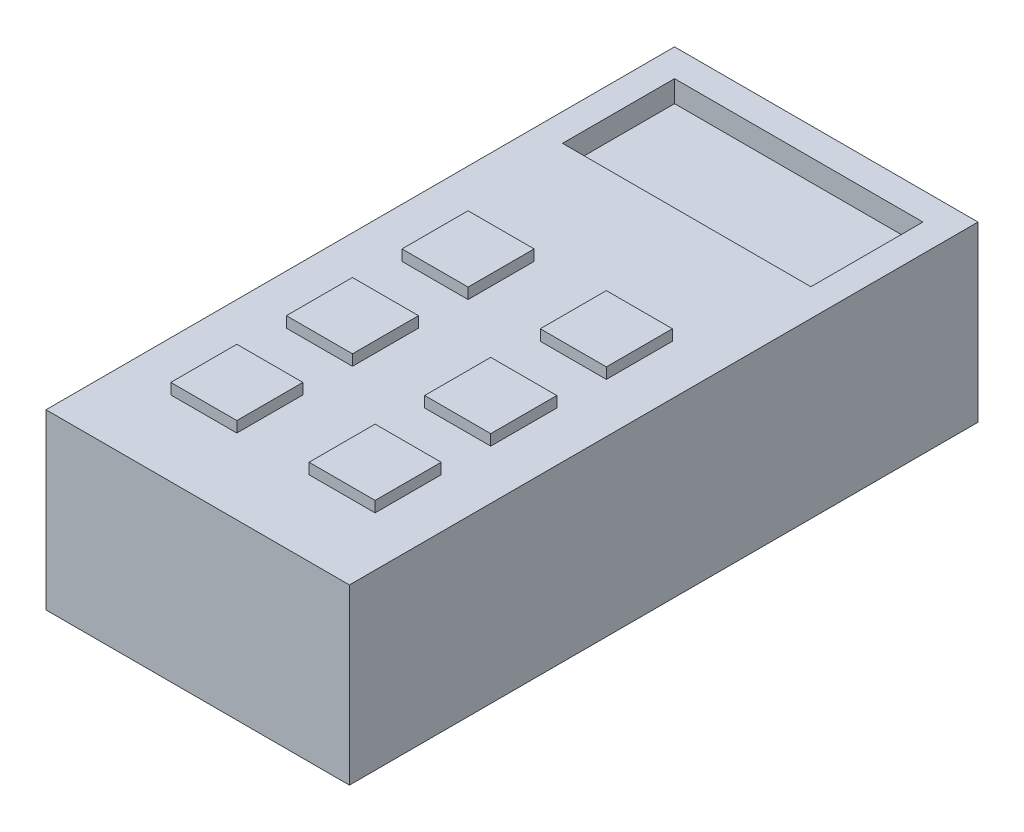
from build123d import *

# Parameters (mm, degrees)
SKETCH1_W           = 70
SKETCH1_H           = 145
BOSS_EXTRUDE1_DEPTH = 40
SKETCH2_W           = 57.3
SKETCH2_H           = 25.847658175
CUT_EXTRUDE1_DEPTH  = 5
SKETCH3_W           = 15.24
SKETCH3_H           = 15.24
BOSS_EXTRUDE2_DEPTH = 2.5
LPATTERN1_COUNT     = 3
LPATTERN1_PITCH     = 26.67


with BuildPart() as part:
    # Sketch1 → Boss-Extrude1 (new body)
    with BuildSketch(Plane(origin=(0, 0, 0), x_dir=(1, 0, 0), z_dir=(0, 1, 0))):
        Rectangle(SKETCH1_W, SKETCH1_H)
    extrude(amount=BOSS_EXTRUDE1_DEPTH)

    # Sketch2 → Cut-Extrude1 (cut)
    with BuildSketch(Plane(origin=(0, 40, 0), x_dir=(1, 0, 0), z_dir=(0, 1, 0))):
        with Locations((0, 53.226170913)):
            Rectangle(SKETCH2_W, SKETCH2_H)
    extrude(amount=-CUT_EXTRUDE1_DEPTH, mode=Mode.SUBTRACT)

    # Sketch3 → Boss-Extrude2 (add)
    with BuildSketch(Plane(origin=(0, 40, 0), x_dir=(1, 0, 0), z_dir=(0, 1, 0))):
        with Locations((-15.95, 5.814113942)):
            Rectangle(SKETCH3_W, SKETCH3_H)
        with Locations((15.95, 5.814113942)):
            Rectangle(SKETCH3_W, SKETCH3_H)
    boss_extrude2 = extrude(amount=BOSS_EXTRUDE2_DEPTH)

    # LPattern1: Boss-Extrude2 ×3
    with Locations(*[(0, 0, i * LPATTERN1_PITCH) for i in range(1, LPATTERN1_COUNT)]):
        add(boss_extrude2)


solid = part.part
